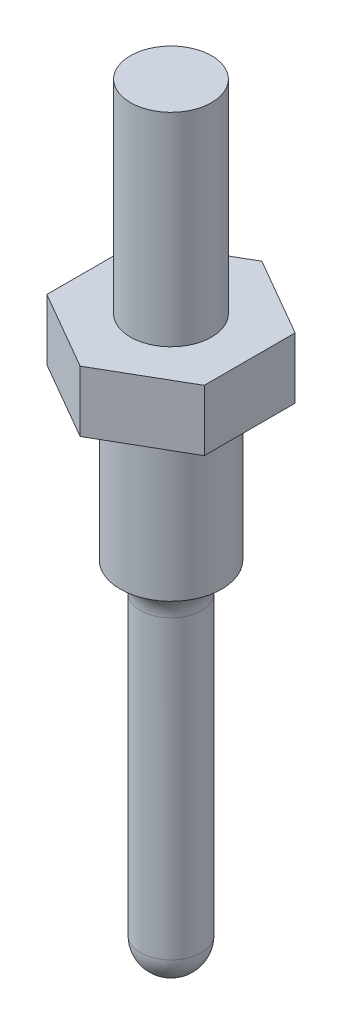
from build123d import *

# Parameters (mm, degrees)
SKETCH1_R           = 3
BOSS_EXTRUDE1_DEPTH = 35
FILLET1_R           = 3
SKETCH2_R           = 5
BOSS_EXTRUDE2_DEPTH = 15
BOSS_EXTRUDE3_DEPTH = 6
SKETCH4_R           = 4
BOSS_EXTRUDE4_DEPTH = 20
FILLET2_R           = 3


with BuildPart() as part:
    # Sketch1 → Boss-Extrude1 (new body)
    with BuildSketch(Plane(origin=(0, 0, 0), x_dir=(1, 0, 0), z_dir=(0, 1, 0))):
        with Locations(Location((0, 0, 0), (0, 0, 270))):
            Circle(SKETCH1_R)
    extrude(amount=BOSS_EXTRUDE1_DEPTH)

    # Fillet1
    fillet1_edges = [part.edges().sort_by_distance(p)[0] for p in [
        (0, 0, -3),
    ]]
    fillet(fillet1_edges, radius=FILLET1_R)

    # Sketch2 → Boss-Extrude2 (add)
    with BuildSketch(Plane(origin=(0, 35, 0), x_dir=(1, 0, 0), z_dir=(0, 1, 0))):
        with Locations(Location((0, 0, 0), (0, 0, 270))):
            Circle(SKETCH2_R)
    extrude(amount=BOSS_EXTRUDE2_DEPTH)

    # Sketch3 → Boss-Extrude3 (add)
    with BuildSketch(Plane(origin=(0, 50, 0), x_dir=(1, 0, 0), z_dir=(0, 1, 0))):
        Polygon((7.75, -4.474464586), (7.75, 4.474464586), (0, 8.948929172), (-7.75, 4.474464586), (-7.75, -4.474464586), (0, -8.948929172), align=None)
    extrude(amount=BOSS_EXTRUDE3_DEPTH)

    # Sketch4 → Boss-Extrude4 (add)
    with BuildSketch(Plane(origin=(0, 56, 0), x_dir=(1, 0, 0), z_dir=(0, 1, 0))):
        with Locations(Location((0, 0, 0), (0, 0, 270))):
            Circle(SKETCH4_R)
    extrude(amount=BOSS_EXTRUDE4_DEPTH)

    # Fillet2
    # the kernel refuses this fillet: 3 mm, written as the material it adds along each edge
    with BuildSketch(Plane(origin=(0, 35, 0), x_dir=(0, 0, 1), z_dir=(-1, 0, 0))) as fillet2_piece_1:
        with BuildLine():
            CenterArc((6, -2.828427125), FILLET2_R, 109.471220634, 70.528779366)
            Line((3, -2.828427125), (2.94, -2.828427125))
            Line((2.94, -2.828427125), (2.94, 0))
            Line((2.94, 0), (3, 0.06))
            ThreePointArc((3, 0.06), (4, 0.06), (4.98, 0.056568542))
            Line((4.98, 0.056568542), (5, 0))
        make_face()
    revolve(axis=Axis((0, 35, 0), (0, 1, 0)))


solid = part.part
